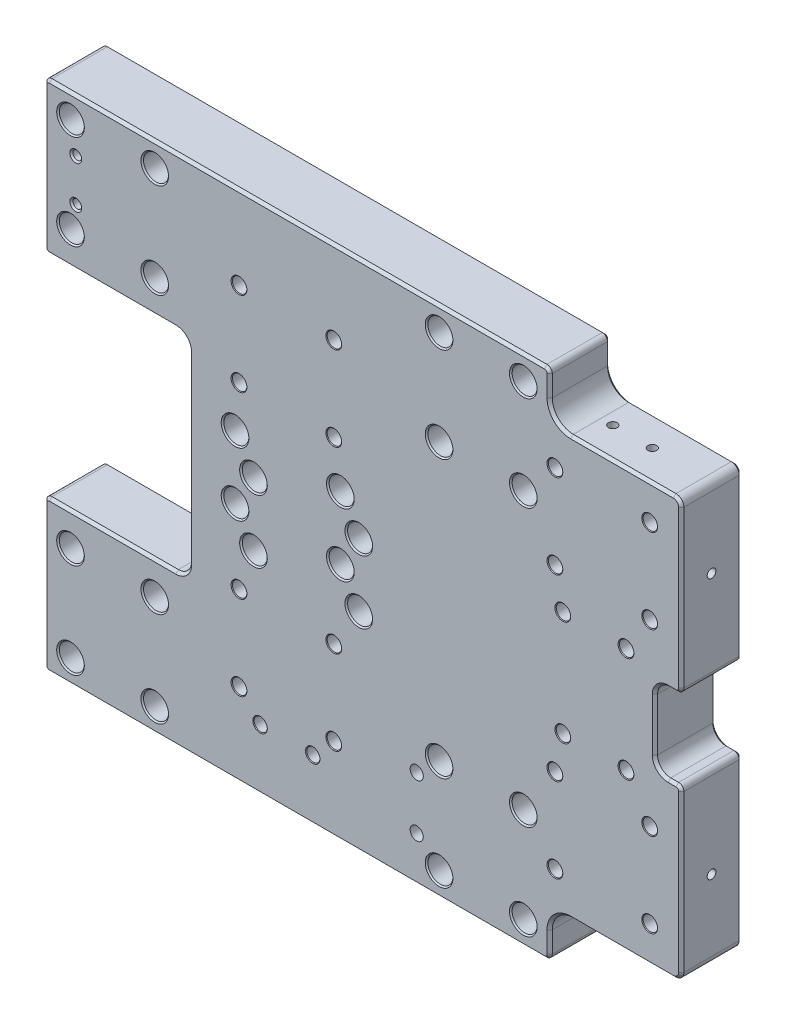
from build123d import *
from OCP.BRepFilletAPI import BRepFilletAPI_MakeFillet

# Parameters (mm, degrees)
SKETCH1_W                                     = 242
SKETCH1_H                                     = 195
BASE_FLANGE1_DEPTH                            = 23
CBORE_FOR_M5_HEX_SOCKET_HEAD_CAP_SCR_2_COUNT  = 2
CBORE_FOR_M5_HEX_SOCKET_HEAD_CAP_SCR_2_PITCH  = 32
CBORE_FOR_M5_HEX_SOCKET_HEAD_CAP_SCR_3_COUNT  = 2
CBORE_FOR_M5_HEX_SOCKET_HEAD_CAP_SCR_3_PITCH  = 48.166378315
CBORE_FOR_M5_HEX_SOCKET_HEAD_CAP_SCR_4_COUNT  = 2
CBORE_FOR_M5_HEX_SOCKET_HEAD_CAP_SCR_4_PITCH  = 36
CBORE_FOR_M5_HEX_SOCKET_HEAD_CAP_SCR_5_COUNT  = 2
CBORE_FOR_M5_HEX_SOCKET_HEAD_CAP_SCR_5_PITCH  = 140
CBORE_FOR_M5_HEX_SOCKET_HEAD_CAP_SCR_6_COUNT  = 2
CBORE_FOR_M5_HEX_SOCKET_HEAD_CAP_SCR_6_PITCH  = 172
CBORE_FOR_M5_HEX_SOCKET_HEAD_CAP_SCR_7_COUNT  = 2
CBORE_FOR_M5_HEX_SOCKET_HEAD_CAP_SCR_7_PITCH  = 175.727061092
CBORE_FOR_M5_HEX_SOCKET_HEAD_CAP_SCR_8_COUNT  = 2
CBORE_FOR_M5_HEX_SOCKET_HEAD_CAP_SCR_8_PITCH  = 144.554487997
CBORE_FOR_M5_HEX_SOCKET_HEAD_CAP_SCR_9_COUNT  = 2
CBORE_FOR_M5_HEX_SOCKET_HEAD_CAP_SCR_9_PITCH  = 198.698263707
CBORE_FOR_M5_HEX_SOCKET_HEAD_CAP_SCR_10_COUNT = 2
CBORE_FOR_M5_HEX_SOCKET_HEAD_CAP_SCR_10_PITCH = 222.407284053
CBORE_FOR_M5_HEX_SOCKET_HEAD_CAP_SCR_11_COUNT = 2
CBORE_FOR_M5_HEX_SOCKET_HEAD_CAP_SCR_11_PITCH = 246.805591509
CBORE_FOR_M5_HEX_SOCKET_HEAD_CAP_SCR_12_COUNT = 2
CBORE_FOR_M5_HEX_SOCKET_HEAD_CAP_SCR_12_PITCH = 225.674544422
CBORE_FOR_M5_HEX_SOCKET_HEAD_CAP_SCR_13_COUNT = 2
CBORE_FOR_M5_HEX_SOCKET_HEAD_CAP_SCR_13_PITCH = 141
CBORE_FOR_M5_HEX_SOCKET_HEAD_CAP_SCR_14_COUNT = 2
CBORE_FOR_M5_HEX_SOCKET_HEAD_CAP_SCR_14_PITCH = 144.585614775
CBORE_FOR_M5_HEX_SOCKET_HEAD_CAP_SCR_15_COUNT = 2
CBORE_FOR_M5_HEX_SOCKET_HEAD_CAP_SCR_15_PITCH = 179.869397064
CBORE_FOR_M5_HEX_SOCKET_HEAD_CAP_SCR_16_COUNT = 2
CBORE_FOR_M5_HEX_SOCKET_HEAD_CAP_SCR_16_PITCH = 177
CBORE_FOR_M5_HEX_SOCKET_HEAD_CAP_SCR_17_COUNT = 2
CBORE_FOR_M5_HEX_SOCKET_HEAD_CAP_SCR_17_PITCH = 40
CBORE_FOR_M5_HEX_SOCKET_HEAD_CAP_SCR_18_COUNT = 2
CBORE_FOR_M5_HEX_SOCKET_HEAD_CAP_SCR_18_PITCH = 46.647615159
CBORE_FOR_M5_HEX_SOCKET_HEAD_CAP_SCR_19_COUNT = 2
CBORE_FOR_M5_HEX_SOCKET_HEAD_CAP_SCR_19_PITCH = 24
CBORE_FOR_M5_HEX_SOCKET_HEAD_CAP_SCR_20_COUNT = 2
CBORE_FOR_M5_HEX_SOCKET_HEAD_CAP_SCR_20_PITCH = 13.892443989
CBORE_FOR_M5_HEX_SOCKET_HEAD_CAP_SCR_21_COUNT = 2
CBORE_FOR_M5_HEX_SOCKET_HEAD_CAP_SCR_21_PITCH = 35.114099732
CBORE_FOR_M5_HEX_SOCKET_HEAD_CAP_SCR_22_COUNT = 2
CBORE_FOR_M5_HEX_SOCKET_HEAD_CAP_SCR_22_PITCH = 48.836461788
CBORE_FOR_M5_HEX_SOCKET_HEAD_CAP_SCR_23_COUNT = 2
CBORE_FOR_M5_HEX_SOCKET_HEAD_CAP_SCR_23_PITCH = 36.674241642
CBORE_FOR_M5_HEX_SOCKET_HEAD_CAP_SCR_24_COUNT = 2
CBORE_FOR_M5_HEX_SOCKET_HEAD_CAP_SCR_24_PITCH = 36
CBORE_FOR_M5_HEX_SOCKET_HEAD_CAP_SCR_25_COUNT = 2
CBORE_FOR_M5_HEX_SOCKET_HEAD_CAP_SCR_25_PITCH = 48.166378315
CBORE_FOR_M5_HEX_SOCKET_HEAD_CAP_SCR_26_COUNT = 2
CBORE_FOR_M5_HEX_SOCKET_HEAD_CAP_SCR_26_PITCH = 32
CBORE_FOR_M5_HEX_SOCKET_HEAD_CAP_SCR_27_COUNT = 2
CBORE_FOR_M5_HEX_SOCKET_HEAD_CAP_SCR_27_PITCH = 106.282642045
CBORE_FOR_M5_HEX_SOCKET_HEAD_CAP_SCR_28_COUNT = 2
CBORE_FOR_M5_HEX_SOCKET_HEAD_CAP_SCR_28_PITCH = 136.821051012
CBORE_FOR_M5_HEX_SOCKET_HEAD_CAP_SCR_29_COUNT = 2
CBORE_FOR_M5_HEX_SOCKET_HEAD_CAP_SCR_29_PITCH = 100
CBORE_FOR_M5_HEX_SOCKET_HEAD_CAP_SCR_30_COUNT = 2
CBORE_FOR_M5_HEX_SOCKET_HEAD_CAP_SCR_30_PITCH = 132
CBORE_FOR_M5_HEX_SOCKET_HEAD_CAP_SCR_31_COUNT = 2
CBORE_FOR_M5_HEX_SOCKET_HEAD_CAP_SCR_31_PITCH = 120
CBORE_FOR_M5_HEX_SOCKET_HEAD_CAP_SCR_32_COUNT = 2
CBORE_FOR_M5_HEX_SOCKET_HEAD_CAP_SCR_32_PITCH = 156
CBORE_FOR_M5_HEX_SOCKET_HEAD_CAP_SCR_33_COUNT = 2
CBORE_FOR_M5_HEX_SOCKET_HEAD_CAP_SCR_33_PITCH = 159.248233899
CBORE_FOR_M5_HEX_SOCKET_HEAD_CAP_SCR_34_COUNT = 2
CBORE_FOR_M5_HEX_SOCKET_HEAD_CAP_SCR_34_PITCH = 124.19339757
CBORE_FOR_M5_HEX_SOCKET_HEAD_CAP_SCR_35_COUNT = 2
CBORE_FOR_M5_HEX_SOCKET_HEAD_CAP_SCR_35_PITCH = 185.29975715
CBORE_FOR_M5_HEX_SOCKET_HEAD_CAP_SCR_36_COUNT = 2
CBORE_FOR_M5_HEX_SOCKET_HEAD_CAP_SCR_36_PITCH = 204.352636391
CBORE_FOR_M5_HEX_SOCKET_HEAD_CAP_SCR_37_COUNT = 2
CBORE_FOR_M5_HEX_SOCKET_HEAD_CAP_SCR_37_PITCH = 156.204993518
CBORE_FOR_M5_HEX_SOCKET_HEAD_CAP_SCR_38_COUNT = 2
CBORE_FOR_M5_HEX_SOCKET_HEAD_CAP_SCR_38_PITCH = 178.392824968
CBORE_FOR_M5_HEX_SOCKET_HEAD_CAP_SCR_39_COUNT = 2
CBORE_FOR_M5_HEX_SOCKET_HEAD_CAP_SCR_39_PITCH = 40
CBORE_FOR_M5_HEX_SOCKET_HEAD_CAP_SCR_40_COUNT = 2
CBORE_FOR_M5_HEX_SOCKET_HEAD_CAP_SCR_40_PITCH = 46.647615159
CBORE_FOR_M5_HEX_SOCKET_HEAD_CAP_SCR_41_COUNT = 2
CBORE_FOR_M5_HEX_SOCKET_HEAD_CAP_SCR_41_PITCH = 24
CUT_EXTRUDE1_REACH                            = 159.087
SKETCH14_W                                    = 55
SKETCH14_H                                    = 80
SKETCH14_W_2                                  = 10
SKETCH14_H_2                                  = 30
M4_TAPPED_HOLE1_AT_2_COUNT                    = 2
M4_TAPPED_HOLE1_AT_2_PITCH                    = 16
CUT_EXTRUDE2_REACH                            = 159.087
SKETCH23_W                                    = 50
SKETCH23_H                                    = 18
F_5_0MM_DOWEL_HOLE1_D                         = 5
F_5_0MM_DOWEL_HOLE1_CSINK_D                   = 5.5
F_5_0MM_DOWEL_HOLE1_CSINK_ANGLE               = 90
F_5_0MM_DOWEL_HOLE2_D                         = 5
F_5_0MM_DOWEL_HOLE2_CSINK_D                   = 5.5
F_5_0MM_DOWEL_HOLE2_CSINK_ANGLE               = 90
FILLET1_R1                                    = 3
FILLET1_R2                                    = 5
FILLET1_R3                                    = 2
FILLET1_R4                                    = 8
CHAMFER1_SIZE                                 = 1
M4_TAPPED_HOLE2_AT_2_COUNT                    = 2
M4_TAPPED_HOLE2_AT_2_PITCH                    = 15


# Sheet-metal steps are written as plain solids
with BuildPart() as part:
    # Sketch1 → Base-Flange1 (new body)
    with BuildSketch(Plane.XY):
        Rectangle(SKETCH1_W, SKETCH1_H)
    extrude(amount=-BASE_FLANGE1_DEPTH)

    # Sketch8 → CBORE for M5 Hex Socket Head Cap Screw1 (revolve, cut)
    with BuildSketch(Plane(origin=(61, 88.5, 0), x_dir=(0, -1, 0), z_dir=(1, 0, 0))):
        Polygon((0, 0), (0, 23), (3, 23), (2.75, 22.75), (2.75, 8), (4.75, 8), (4.75, 0.5), (5.25, 0), align=None)
    cbore_for_m5_hex_socket_head_cap_screw1 = revolve(axis=Axis((61, 88.5, 6.35), (0, 0, -1)), mode=Mode.SUBTRACT)

    # CBORE for M5 Hex Socket Head Cap Scr 2: CBORE for M5 Hex Socket Head Cap Screw1 ×2
    with Locations(*[(-i * CBORE_FOR_M5_HEX_SOCKET_HEAD_CAP_SCR_2_PITCH, 0, 0) for i in range(1, CBORE_FOR_M5_HEX_SOCKET_HEAD_CAP_SCR_2_COUNT)]):
        add(cbore_for_m5_hex_socket_head_cap_screw1, mode=Mode.SUBTRACT)

    # CBORE for M5 Hex Socket Head Cap Scr 3: CBORE for M5 Hex Socket Head Cap Screw1 ×2
    with Locations(*[Vector(-0.6643638388299198, -0.7474093186836599, 0) * (i * CBORE_FOR_M5_HEX_SOCKET_HEAD_CAP_SCR_3_PITCH) for i in range(1, CBORE_FOR_M5_HEX_SOCKET_HEAD_CAP_SCR_3_COUNT)]):
        add(cbore_for_m5_hex_socket_head_cap_screw1, mode=Mode.SUBTRACT)

    # CBORE for M5 Hex Socket Head Cap Scr 4: CBORE for M5 Hex Socket Head Cap Screw1 ×2
    with Locations(*[(0, -i * CBORE_FOR_M5_HEX_SOCKET_HEAD_CAP_SCR_4_PITCH, 0) for i in range(1, CBORE_FOR_M5_HEX_SOCKET_HEAD_CAP_SCR_4_COUNT)]):
        add(cbore_for_m5_hex_socket_head_cap_screw1, mode=Mode.SUBTRACT)

    # CBORE for M5 Hex Socket Head Cap Scr 5: CBORE for M5 Hex Socket Head Cap Screw1 ×2
    with Locations(*[(-i * CBORE_FOR_M5_HEX_SOCKET_HEAD_CAP_SCR_5_PITCH, 0, 0) for i in range(1, CBORE_FOR_M5_HEX_SOCKET_HEAD_CAP_SCR_5_COUNT)]):
        add(cbore_for_m5_hex_socket_head_cap_screw1, mode=Mode.SUBTRACT)

    # CBORE for M5 Hex Socket Head Cap Scr 6: CBORE for M5 Hex Socket Head Cap Screw1 ×2
    with Locations(*[(-i * CBORE_FOR_M5_HEX_SOCKET_HEAD_CAP_SCR_6_PITCH, 0, 0) for i in range(1, CBORE_FOR_M5_HEX_SOCKET_HEAD_CAP_SCR_6_COUNT)]):
        add(cbore_for_m5_hex_socket_head_cap_screw1, mode=Mode.SUBTRACT)

    # CBORE for M5 Hex Socket Head Cap Scr 7: CBORE for M5 Hex Socket Head Cap Screw1 ×2
    with Locations(*[Vector(-0.9787906252528686, -0.20486315412269354, 0) * (i * CBORE_FOR_M5_HEX_SOCKET_HEAD_CAP_SCR_7_PITCH) for i in range(1, CBORE_FOR_M5_HEX_SOCKET_HEAD_CAP_SCR_7_COUNT)]):
        add(cbore_for_m5_hex_socket_head_cap_screw1, mode=Mode.SUBTRACT)

    # CBORE for M5 Hex Socket Head Cap Scr 8: CBORE for M5 Hex Socket Head Cap Screw1 ×2
    with Locations(*[Vector(-0.9684929325968497, -0.24904103981061862, 0) * (i * CBORE_FOR_M5_HEX_SOCKET_HEAD_CAP_SCR_8_PITCH) for i in range(1, CBORE_FOR_M5_HEX_SOCKET_HEAD_CAP_SCR_8_COUNT)]):
        add(cbore_for_m5_hex_socket_head_cap_screw1, mode=Mode.SUBTRACT)

    # CBORE for M5 Hex Socket Head Cap Scr 9: CBORE for M5 Hex Socket Head Cap Screw1 ×2
    with Locations(*[Vector(-0.7045859253544188, -0.7096186819640937, 0) * (i * CBORE_FOR_M5_HEX_SOCKET_HEAD_CAP_SCR_9_PITCH) for i in range(1, CBORE_FOR_M5_HEX_SOCKET_HEAD_CAP_SCR_9_COUNT)]):
        add(cbore_for_m5_hex_socket_head_cap_screw1, mode=Mode.SUBTRACT)

    # CBORE for M5 Hex Socket Head Cap Scr 10: CBORE for M5 Hex Socket Head Cap Screw1 ×2
    with Locations(*[Vector(-0.7733559659796021, -0.6339720418786277, 0) * (i * CBORE_FOR_M5_HEX_SOCKET_HEAD_CAP_SCR_10_PITCH) for i in range(1, CBORE_FOR_M5_HEX_SOCKET_HEAD_CAP_SCR_10_COUNT)]):
        add(cbore_for_m5_hex_socket_head_cap_screw1, mode=Mode.SUBTRACT)

    # CBORE for M5 Hex Socket Head Cap Scr 11: CBORE for M5 Hex Socket Head Cap Screw1 ×2
    with Locations(*[Vector(-0.6969047943708334, -0.7171636546723115, 0) * (i * CBORE_FOR_M5_HEX_SOCKET_HEAD_CAP_SCR_11_PITCH) for i in range(1, CBORE_FOR_M5_HEX_SOCKET_HEAD_CAP_SCR_11_COUNT)]):
        add(cbore_for_m5_hex_socket_head_cap_screw1, mode=Mode.SUBTRACT)

    # CBORE for M5 Hex Socket Head Cap Scr 12: CBORE for M5 Hex Socket Head Cap Screw1 ×2
    with Locations(*[Vector(-0.6203623911534888, -0.7843153088154827, 0) * (i * CBORE_FOR_M5_HEX_SOCKET_HEAD_CAP_SCR_12_PITCH) for i in range(1, CBORE_FOR_M5_HEX_SOCKET_HEAD_CAP_SCR_12_COUNT)]):
        add(cbore_for_m5_hex_socket_head_cap_screw1, mode=Mode.SUBTRACT)

    # CBORE for M5 Hex Socket Head Cap Scr 13: CBORE for M5 Hex Socket Head Cap Screw1 ×2
    with Locations(*[(0, -i * CBORE_FOR_M5_HEX_SOCKET_HEAD_CAP_SCR_13_PITCH, 0) for i in range(1, CBORE_FOR_M5_HEX_SOCKET_HEAD_CAP_SCR_13_COUNT)]):
        add(cbore_for_m5_hex_socket_head_cap_screw1, mode=Mode.SUBTRACT)

    # CBORE for M5 Hex Socket Head Cap Scr 14: CBORE for M5 Hex Socket Head Cap Screw1 ×2
    with Locations(*[Vector(-0.2213221560782096, -0.9752007502196113, 0) * (i * CBORE_FOR_M5_HEX_SOCKET_HEAD_CAP_SCR_14_PITCH) for i in range(1, CBORE_FOR_M5_HEX_SOCKET_HEAD_CAP_SCR_14_COUNT)]):
        add(cbore_for_m5_hex_socket_head_cap_screw1, mode=Mode.SUBTRACT)

    # CBORE for M5 Hex Socket Head Cap Scr 15: CBORE for M5 Hex Socket Head Cap Screw1 ×2
    with Locations(*[Vector(-0.17790686199218475, -0.9840473303942722, 0) * (i * CBORE_FOR_M5_HEX_SOCKET_HEAD_CAP_SCR_15_PITCH) for i in range(1, CBORE_FOR_M5_HEX_SOCKET_HEAD_CAP_SCR_15_COUNT)]):
        add(cbore_for_m5_hex_socket_head_cap_screw1, mode=Mode.SUBTRACT)

    # CBORE for M5 Hex Socket Head Cap Scr 16: CBORE for M5 Hex Socket Head Cap Screw1 ×2
    with Locations(*[(0, -i * CBORE_FOR_M5_HEX_SOCKET_HEAD_CAP_SCR_16_PITCH, 0) for i in range(1, CBORE_FOR_M5_HEX_SOCKET_HEAD_CAP_SCR_16_COUNT)]):
        add(cbore_for_m5_hex_socket_head_cap_screw1, mode=Mode.SUBTRACT)

    # Sketch10 → CBORE for M5 Hex Socket Head Cap Screw2 (revolve, cut)
    with BuildSketch(Plane(origin=(-8.5, 17.5, 0), x_dir=(0, -1, 0), z_dir=(1, 0, 0))):
        Polygon((0, 0), (0, 23), (3, 23), (2.75, 22.75), (2.75, 8), (4.75, 8), (4.75, 0.5), (5.25, 0), align=None)
    cbore_for_m5_hex_socket_head_cap_screw2 = revolve(axis=Axis((-8.5, 17.5, 6.35), (0, 0, -1)), mode=Mode.SUBTRACT)

    # CBORE for M5 Hex Socket Head Cap Scr 17: CBORE for M5 Hex Socket Head Cap Screw2 ×2
    with Locations(*[(-i * CBORE_FOR_M5_HEX_SOCKET_HEAD_CAP_SCR_17_PITCH, 0, 0) for i in range(1, CBORE_FOR_M5_HEX_SOCKET_HEAD_CAP_SCR_17_COUNT)]):
        add(cbore_for_m5_hex_socket_head_cap_screw2, mode=Mode.SUBTRACT)

    # CBORE for M5 Hex Socket Head Cap Scr 18: CBORE for M5 Hex Socket Head Cap Screw2 ×2
    with Locations(*[Vector(-0.8574929257125441, -0.5144957554275267, 0) * (i * CBORE_FOR_M5_HEX_SOCKET_HEAD_CAP_SCR_18_PITCH) for i in range(1, CBORE_FOR_M5_HEX_SOCKET_HEAD_CAP_SCR_18_COUNT)]):
        add(cbore_for_m5_hex_socket_head_cap_screw2, mode=Mode.SUBTRACT)

    # CBORE for M5 Hex Socket Head Cap Scr 19: CBORE for M5 Hex Socket Head Cap Screw2 ×2
    with Locations(*[(0, -i * CBORE_FOR_M5_HEX_SOCKET_HEAD_CAP_SCR_19_PITCH, 0) for i in range(1, CBORE_FOR_M5_HEX_SOCKET_HEAD_CAP_SCR_19_COUNT)]):
        add(cbore_for_m5_hex_socket_head_cap_screw2, mode=Mode.SUBTRACT)

    # CBORE for M5 Hex Socket Head Cap Scr 20: CBORE for M5 Hex Socket Head Cap Screw2 ×2
    with Locations(*[Vector(0.5038710255240865, -0.8637789008984332, 0) * (i * CBORE_FOR_M5_HEX_SOCKET_HEAD_CAP_SCR_20_PITCH) for i in range(1, CBORE_FOR_M5_HEX_SOCKET_HEAD_CAP_SCR_20_COUNT)]):
        add(cbore_for_m5_hex_socket_head_cap_screw2, mode=Mode.SUBTRACT)

    # CBORE for M5 Hex Socket Head Cap Scr 21: CBORE for M5 Hex Socket Head Cap Screw2 ×2
    with Locations(*[Vector(-0.9397934234884372, -0.34174306308670416, 0) * (i * CBORE_FOR_M5_HEX_SOCKET_HEAD_CAP_SCR_21_PITCH) for i in range(1, CBORE_FOR_M5_HEX_SOCKET_HEAD_CAP_SCR_21_COUNT)]):
        add(cbore_for_m5_hex_socket_head_cap_screw2, mode=Mode.SUBTRACT)

    # CBORE for M5 Hex Socket Head Cap Scr 22: CBORE for M5 Hex Socket Head Cap Screw2 ×2
    with Locations(*[Vector(-0.6757246285173464, -0.7371541402007413, 0) * (i * CBORE_FOR_M5_HEX_SOCKET_HEAD_CAP_SCR_22_PITCH) for i in range(1, CBORE_FOR_M5_HEX_SOCKET_HEAD_CAP_SCR_22_COUNT)]):
        add(cbore_for_m5_hex_socket_head_cap_screw2, mode=Mode.SUBTRACT)

    # CBORE for M5 Hex Socket Head Cap Scr 23: CBORE for M5 Hex Socket Head Cap Screw2 ×2
    with Locations(*[Vector(0.19086965910222412, -0.9816153896685813, 0) * (i * CBORE_FOR_M5_HEX_SOCKET_HEAD_CAP_SCR_23_PITCH) for i in range(1, CBORE_FOR_M5_HEX_SOCKET_HEAD_CAP_SCR_23_COUNT)]):
        add(cbore_for_m5_hex_socket_head_cap_screw2, mode=Mode.SUBTRACT)

    # Sketch13 → CBORE for M5 Hex Socket Head Cap Screw3 (revolve, cut)
    with BuildSketch(Plane(origin=(-47, 66, -23), x_dir=(0, 1, 0), z_dir=(1, 0, 0))):
        Polygon((0, 0), (0, 23), (3, 23), (2.75, 22.75), (2.75, 8), (4.75, 8), (4.75, 0.5), (5.25, 0), align=None)
    cbore_for_m5_hex_socket_head_cap_screw3 = revolve(axis=Axis((-47, 66, -29.35), (0, 0, 1)), mode=Mode.SUBTRACT)

    # CBORE for M5 Hex Socket Head Cap Scr 24: CBORE for M5 Hex Socket Head Cap Screw3 ×2
    with Locations(*[(i * CBORE_FOR_M5_HEX_SOCKET_HEAD_CAP_SCR_24_PITCH, 0, 0) for i in range(1, CBORE_FOR_M5_HEX_SOCKET_HEAD_CAP_SCR_24_COUNT)]):
        add(cbore_for_m5_hex_socket_head_cap_screw3, mode=Mode.SUBTRACT)

    # CBORE for M5 Hex Socket Head Cap Scr 25: CBORE for M5 Hex Socket Head Cap Screw3 ×2
    with Locations(*[Vector(0.7474093186836551, -0.6643638388299249, 0) * (i * CBORE_FOR_M5_HEX_SOCKET_HEAD_CAP_SCR_25_PITCH) for i in range(1, CBORE_FOR_M5_HEX_SOCKET_HEAD_CAP_SCR_25_COUNT)]):
        add(cbore_for_m5_hex_socket_head_cap_screw3, mode=Mode.SUBTRACT)

    # CBORE for M5 Hex Socket Head Cap Scr 26: CBORE for M5 Hex Socket Head Cap Screw3 ×2
    with Locations(*[(0, -i * CBORE_FOR_M5_HEX_SOCKET_HEAD_CAP_SCR_26_PITCH, 0) for i in range(1, CBORE_FOR_M5_HEX_SOCKET_HEAD_CAP_SCR_26_COUNT)]):
        add(cbore_for_m5_hex_socket_head_cap_screw3, mode=Mode.SUBTRACT)

    # CBORE for M5 Hex Socket Head Cap Scr 27: CBORE for M5 Hex Socket Head Cap Screw3 ×2
    with Locations(*[Vector(0.3387194682727424, -0.9408874118687266, 0) * (i * CBORE_FOR_M5_HEX_SOCKET_HEAD_CAP_SCR_27_PITCH) for i in range(1, CBORE_FOR_M5_HEX_SOCKET_HEAD_CAP_SCR_27_COUNT)]):
        add(cbore_for_m5_hex_socket_head_cap_screw3, mode=Mode.SUBTRACT)

    # CBORE for M5 Hex Socket Head Cap Scr 28: CBORE for M5 Hex Socket Head Cap Screw3 ×2
    with Locations(*[Vector(0.2631174057921073, -0.9647638212377325, 0) * (i * CBORE_FOR_M5_HEX_SOCKET_HEAD_CAP_SCR_28_PITCH) for i in range(1, CBORE_FOR_M5_HEX_SOCKET_HEAD_CAP_SCR_28_COUNT)]):
        add(cbore_for_m5_hex_socket_head_cap_screw3, mode=Mode.SUBTRACT)

    # CBORE for M5 Hex Socket Head Cap Scr 29: CBORE for M5 Hex Socket Head Cap Screw3 ×2
    with Locations(*[(0, -i * CBORE_FOR_M5_HEX_SOCKET_HEAD_CAP_SCR_29_PITCH, 0) for i in range(1, CBORE_FOR_M5_HEX_SOCKET_HEAD_CAP_SCR_29_COUNT)]):
        add(cbore_for_m5_hex_socket_head_cap_screw3, mode=Mode.SUBTRACT)

    # CBORE for M5 Hex Socket Head Cap Scr 30: CBORE for M5 Hex Socket Head Cap Screw3 ×2
    with Locations(*[(0, -i * CBORE_FOR_M5_HEX_SOCKET_HEAD_CAP_SCR_30_PITCH, 0) for i in range(1, CBORE_FOR_M5_HEX_SOCKET_HEAD_CAP_SCR_30_COUNT)]):
        add(cbore_for_m5_hex_socket_head_cap_screw3, mode=Mode.SUBTRACT)

    # CBORE for M5 Hex Socket Head Cap Scr 31: CBORE for M5 Hex Socket Head Cap Screw3 ×2
    with Locations(*[(i * CBORE_FOR_M5_HEX_SOCKET_HEAD_CAP_SCR_31_PITCH, 0, 0) for i in range(1, CBORE_FOR_M5_HEX_SOCKET_HEAD_CAP_SCR_31_COUNT)]):
        add(cbore_for_m5_hex_socket_head_cap_screw3, mode=Mode.SUBTRACT)

    # CBORE for M5 Hex Socket Head Cap Scr 32: CBORE for M5 Hex Socket Head Cap Screw3 ×2
    with Locations(*[(i * CBORE_FOR_M5_HEX_SOCKET_HEAD_CAP_SCR_32_PITCH, 0, 0) for i in range(1, CBORE_FOR_M5_HEX_SOCKET_HEAD_CAP_SCR_32_COUNT)]):
        add(cbore_for_m5_hex_socket_head_cap_screw3, mode=Mode.SUBTRACT)

    # CBORE for M5 Hex Socket Head Cap Scr 33: CBORE for M5 Hex Socket Head Cap Screw3 ×2
    with Locations(*[Vector(0.9796027006414888, -0.20094414372133815, 0) * (i * CBORE_FOR_M5_HEX_SOCKET_HEAD_CAP_SCR_33_PITCH) for i in range(1, CBORE_FOR_M5_HEX_SOCKET_HEAD_CAP_SCR_33_COUNT)]):
        add(cbore_for_m5_hex_socket_head_cap_screw3, mode=Mode.SUBTRACT)

    # CBORE for M5 Hex Socket Head Cap Scr 34: CBORE for M5 Hex Socket Head Cap Screw3 ×2
    with Locations(*[Vector(0.9662349396012445, -0.25766265056033916, 0) * (i * CBORE_FOR_M5_HEX_SOCKET_HEAD_CAP_SCR_34_PITCH) for i in range(1, CBORE_FOR_M5_HEX_SOCKET_HEAD_CAP_SCR_34_COUNT)]):
        add(cbore_for_m5_hex_socket_head_cap_screw3, mode=Mode.SUBTRACT)

    # CBORE for M5 Hex Socket Head Cap Scr 35: CBORE for M5 Hex Socket Head Cap Screw3 ×2
    with Locations(*[Vector(0.8418791389638736, -0.5396661147204326, 0) * (i * CBORE_FOR_M5_HEX_SOCKET_HEAD_CAP_SCR_35_PITCH) for i in range(1, CBORE_FOR_M5_HEX_SOCKET_HEAD_CAP_SCR_35_COUNT)]):
        add(cbore_for_m5_hex_socket_head_cap_screw3, mode=Mode.SUBTRACT)

    # CBORE for M5 Hex Socket Head Cap Scr 36: CBORE for M5 Hex Socket Head Cap Screw3 ×2
    with Locations(*[Vector(0.7633862853691121, -0.6459422414661768, 0) * (i * CBORE_FOR_M5_HEX_SOCKET_HEAD_CAP_SCR_36_PITCH) for i in range(1, CBORE_FOR_M5_HEX_SOCKET_HEAD_CAP_SCR_36_COUNT)]):
        add(cbore_for_m5_hex_socket_head_cap_screw3, mode=Mode.SUBTRACT)

    # CBORE for M5 Hex Socket Head Cap Scr 37: CBORE for M5 Hex Socket Head Cap Screw3 ×2
    with Locations(*[Vector(0.7682212795973714, -0.6401843996644853, 0) * (i * CBORE_FOR_M5_HEX_SOCKET_HEAD_CAP_SCR_37_PITCH) for i in range(1, CBORE_FOR_M5_HEX_SOCKET_HEAD_CAP_SCR_37_COUNT)]):
        add(cbore_for_m5_hex_socket_head_cap_screw3, mode=Mode.SUBTRACT)

    # CBORE for M5 Hex Socket Head Cap Scr 38: CBORE for M5 Hex Socket Head Cap Screw3 ×2
    with Locations(*[Vector(0.672672793996308, -0.7399400733959478, 0) * (i * CBORE_FOR_M5_HEX_SOCKET_HEAD_CAP_SCR_38_PITCH) for i in range(1, CBORE_FOR_M5_HEX_SOCKET_HEAD_CAP_SCR_38_COUNT)]):
        add(cbore_for_m5_hex_socket_head_cap_screw3, mode=Mode.SUBTRACT)

    # Sketch16 → CBORE for M5 Hex Socket Head Cap Screw4 (revolve, cut)
    with BuildSketch(Plane(origin=(100, 20, -23), x_dir=(0, 1, 0), z_dir=(1, 0, 0))):
        Polygon((0, 0), (0, 23), (3, 23), (2.75, 22.75), (2.75, 8), (4.75, 8), (4.75, 0.5), (5.25, 0), align=None)
    cbore_for_m5_hex_socket_head_cap_screw4 = revolve(axis=Axis((100, 20, -29.35), (0, 0, 1)), mode=Mode.SUBTRACT)

    # CBORE for M5 Hex Socket Head Cap Scr 39: CBORE for M5 Hex Socket Head Cap Screw4 ×2
    with Locations(*[(0, -i * CBORE_FOR_M5_HEX_SOCKET_HEAD_CAP_SCR_39_PITCH, 0) for i in range(1, CBORE_FOR_M5_HEX_SOCKET_HEAD_CAP_SCR_39_COUNT)]):
        add(cbore_for_m5_hex_socket_head_cap_screw4, mode=Mode.SUBTRACT)

    # CBORE for M5 Hex Socket Head Cap Scr 40: CBORE for M5 Hex Socket Head Cap Screw4 ×2
    with Locations(*[Vector(-0.5144957554275263, -0.8574929257125444, 0) * (i * CBORE_FOR_M5_HEX_SOCKET_HEAD_CAP_SCR_40_PITCH) for i in range(1, CBORE_FOR_M5_HEX_SOCKET_HEAD_CAP_SCR_40_COUNT)]):
        add(cbore_for_m5_hex_socket_head_cap_screw4, mode=Mode.SUBTRACT)

    # CBORE for M5 Hex Socket Head Cap Scr 41: CBORE for M5 Hex Socket Head Cap Screw4 ×2
    with Locations(*[(-i * CBORE_FOR_M5_HEX_SOCKET_HEAD_CAP_SCR_41_PITCH, 0, 0) for i in range(1, CBORE_FOR_M5_HEX_SOCKET_HEAD_CAP_SCR_41_COUNT)]):
        add(cbore_for_m5_hex_socket_head_cap_screw4, mode=Mode.SUBTRACT)

    # Sketch14 → Cut-Extrude1 (cut, up to next)
    with BuildSketch(Plane(origin=(0, 0, -23), x_dir=(-1, 0, 0), z_dir=(0, 0, -1)), mode=Mode.PRIVATE) as cut_extrude1_sk1:
        with Locations((93.5, 0)):
            Rectangle(SKETCH14_W, SKETCH14_H)
    cut_extrude1_tool1 = extrude(cut_extrude1_sk1.sketch, amount=-CUT_EXTRUDE1_REACH, mode=Mode.PRIVATE) & part.part
    # Sketch14 → Cut-Extrude1 (cut, up to next)
    with BuildSketch(Plane(origin=(0, 0, -23), x_dir=(-1, 0, 0), z_dir=(0, 0, -1)), mode=Mode.PRIVATE) as cut_extrude1_sk2:
        with Locations((-116, 0)):
            Rectangle(SKETCH14_W_2, SKETCH14_H_2)
    cut_extrude1_tool2 = extrude(cut_extrude1_sk2.sketch, amount=-CUT_EXTRUDE1_REACH, mode=Mode.PRIVATE) & part.part
    add(cut_extrude1_tool1.solids().sort_by_distance((-93.5, 0, -23))[0], mode=Mode.SUBTRACT)
    add(cut_extrude1_tool2.solids().sort_by_distance((116, 0, -23))[0], mode=Mode.SUBTRACT)

    # Sketch22 → M4 Tapped Hole1 (revolve, cut)
    with BuildSketch(Plane(origin=(-109, 77.5, 0), x_dir=(0, -1, 0), z_dir=(1, 0, 0))):
        Polygon((0, 0), (0, 23), (2.25, 23), (1.65, 22.4), (1.65, 0.6), (2.25, 0), align=None)
    m4_tapped_hole1 = revolve(axis=Axis((-109, 77.5, 6.35), (0, 0, -1)), mode=Mode.SUBTRACT)

    # M4 Tapped Hole1 at 2: M4 Tapped Hole1 ×2
    with Locations(*[(0, -i * M4_TAPPED_HOLE1_AT_2_PITCH, 0) for i in range(1, M4_TAPPED_HOLE1_AT_2_COUNT)]):
        add(m4_tapped_hole1, mode=Mode.SUBTRACT)

    # Sketch23 → Cut-Extrude2 (cut, up to next)
    with BuildSketch(Plane.XY, mode=Mode.PRIVATE) as cut_extrude2_sk1:
        with Locations((96, 88.5)):
            Rectangle(SKETCH23_W, SKETCH23_H)
    cut_extrude2_tool1 = extrude(cut_extrude2_sk1.sketch, amount=-CUT_EXTRUDE2_REACH, mode=Mode.PRIVATE) & part.part
    # Sketch23 → Cut-Extrude2 (cut, up to next)
    with BuildSketch(Plane.XY, mode=Mode.PRIVATE) as cut_extrude2_sk2:
        with Locations((96, -88.5)):
            Rectangle(SKETCH23_W, SKETCH23_H)
    cut_extrude2_tool2 = extrude(cut_extrude2_sk2.sketch, amount=-CUT_EXTRUDE2_REACH, mode=Mode.PRIVATE) & part.part
    add(cut_extrude2_tool1.solids().sort_by_distance((96, 88.5, 0))[0], mode=Mode.SUBTRACT)
    add(cut_extrude2_tool2.solids().sort_by_distance((96, -88.5, 0))[0], mode=Mode.SUBTRACT)

    # Ø5.0mm Dowel Hole1 (through all)
    with Locations(Plane(origin=(0, 0, -23), x_dir=(-1, 0, 0), z_dir=(0, 0, -1))):
        with Locations((-20.5, -80.5), (-20.5, -60.5)):
            CounterSinkHole(F_5_0MM_DOWEL_HOLE1_D / 2, F_5_0MM_DOWEL_HOLE1_CSINK_D / 2, counter_sink_angle=F_5_0MM_DOWEL_HOLE1_CSINK_ANGLE)

    # Ø5.0mm Dowel Hole2 (through all)
    with Locations(Plane.XY):
        with Locations((-19, -74.5), (-39, -74.5)):
            CounterSinkHole(F_5_0MM_DOWEL_HOLE2_D / 2, F_5_0MM_DOWEL_HOLE2_CSINK_D / 2, counter_sink_angle=F_5_0MM_DOWEL_HOLE2_CSINK_ANGLE)

    # Fillet1: one fillet with a radius per group of edges: ONE call of the kernel's fillet builder (fillet() takes one radius for all edges)
    fillet1_edges_1 = [part.edges().sort_by_distance(p)[0] for p in [
        (121, -79.5, -11.5),
        (121, 79.5, -11.5),
    ]]
    fillet1_edges_2 = [part.edges().sort_by_distance(p)[0] for p in [
        (-66, 40, -11.5),
        (-66, -40, -11.5),
        (111, -15, -11.5),
        (111, 15, -11.5),
    ]]
    fillet1_edges_3 = [part.edges().sort_by_distance(p)[0] for p in [
        (-121, 97.5, -11.5),
        (-121, 40, -11.5),
        (-121, -40, -11.5),
        (-121, -97.5, -11.5),
        (121, -15, -11.5),
        (121, 15, -11.5),
        (71, -97.5, -11.5),
        (71, 97.5, -11.5),
    ]]
    fillet1_edges_4 = [part.edges().sort_by_distance(p)[0] for p in [
        (71, -79.5, -11.5),
        (71, 79.5, -11.5),
    ]]
    fillet1 = BRepFilletAPI_MakeFillet(part.part.solid().wrapped)
    for e in fillet1_edges_1:
        fillet1.Add(FILLET1_R1, e.wrapped)
    for e in fillet1_edges_2:
        fillet1.Add(FILLET1_R2, e.wrapped)
    for e in fillet1_edges_3:
        fillet1.Add(FILLET1_R3, e.wrapped)
    for e in fillet1_edges_4:
        fillet1.Add(FILLET1_R4, e.wrapped)
    add(Compound.cast(fillet1.Shape()), mode=Mode.REPLACE)

    # Chamfer1
    chamfer1_edges = [part.edges().sort_by_distance(p)[0] for p in [
        (98.5, 79.5, 0),
        (98.5, 79.5, -23),
        (71, 91.5, 0),
        (71, 91.5, -23),
        (71, -91.5, 0),
        (71, -91.5, -23),
        (98.5, -79.5, 0),
        (98.5, -79.5, -23),
        (-25, 97.5, 0),
        (-121, 68.75, 0),
        (-95, 40, 0),
        (-66, 0, 0),
        (-95, -40, 0),
        (-121, -68.75, 0),
        (-25, -97.5, 0),
        (121, -46.75, 0),
        (117.5, -15, 0),
        (111, 0, 0),
        (117.5, 15, 0),
        (121, 46.75, 0),
        (120.121320344, -78.621320344, 0),
        (120.121320344, 78.621320344, 0),
        (-120.414213562, 96.914213562, 0),
        (-120.414213562, 40.585786438, 0),
        (-120.414213562, -40.585786438, 0),
        (-120.414213562, -96.914213562, 0),
        (120.414213562, -15.585786438, 0),
        (120.414213562, 15.585786438, 0),
        (70.414213562, -96.914213562, 0),
        (70.414213562, 96.914213562, 0),
        (-25, 97.5, -23),
        (121, 46.75, -23),
        (117.5, 15, -23),
        (111, 0, -23),
        (117.5, -15, -23),
        (121, -46.75, -23),
        (-25, -97.5, -23),
        (-121, -68.75, -23),
        (-95, -40, -23),
        (-66, 0, -23),
        (-95, 40, -23),
        (-121, 68.75, -23),
        (120.121320344, -78.621320344, -23),
        (120.121320344, 78.621320344, -23),
        (-120.414213562, 96.914213562, -23),
        (-120.414213562, 40.585786438, -23),
        (-120.414213562, -40.585786438, -23),
        (-120.414213562, -96.914213562, -23),
        (120.414213562, -15.585786438, -23),
        (120.414213562, 15.585786438, -23),
        (70.414213562, -96.914213562, -23),
        (70.414213562, 96.914213562, -23),
        (73.343145751, 81.843145751, 0),
        (73.343145751, 81.843145751, -23),
        (73.343145751, -81.843145751, 0),
        (73.343145751, -81.843145751, -23),
        (112.464466094, 13.535533906, -23),
        (112.464466094, 13.535533906, 0),
        (112.464466094, -13.535533906, -23),
        (112.464466094, -13.535533906, 0),
        (-67.464466094, -38.535533906, -23),
        (-67.464466094, -38.535533906, 0),
        (-67.464466094, 38.535533906, -23),
        (-67.464466094, 38.535533906, 0),
    ]]
    chamfer(chamfer1_edges, length=CHAMFER1_SIZE)

    # Sketch30 → M4 Tapped Hole2 (revolve, cut)
    with BuildSketch(Plane(origin=(98.5, -79.5, -11.5), x_dir=(0, 0, -1), z_dir=(1, 0, 0))):
        Polygon((0, 0), (0, 11.5), (1.65, 10.508579979), (1.65, 0), align=None)
    m4_tapped_hole2 = revolve(axis=Axis((98.5, -85.85, -11.5), (0, 1, 0)), mode=Mode.SUBTRACT)

    # M4 Tapped Hole2 at 2: M4 Tapped Hole2 ×2
    with Locations(*[(-i * M4_TAPPED_HOLE2_AT_2_PITCH, 0, 0) for i in range(1, M4_TAPPED_HOLE2_AT_2_COUNT)]):
        add(m4_tapped_hole2, mode=Mode.SUBTRACT)

    # Sketch32 → M4 Tapped Hole3 (revolve, cut)
    with BuildSketch(Plane(origin=(121, -49.5, -11.5), x_dir=(0, 0, -1), z_dir=(0, 1, 0))):
        Polygon((0, 0), (0, 11.5), (1.65, 10.508579979), (1.65, 0), align=None)
    m4_tapped_hole3 = revolve(axis=Axis((127.35, -49.5, -11.5), (-1, 0, 0)), mode=Mode.SUBTRACT)

    # Mirror1: M4 Tapped Hole2, M4 Tapped Hole3 across plane
    add(m4_tapped_hole2.mirror(Plane.ZX), mode=Mode.SUBTRACT)
    add(m4_tapped_hole3.mirror(Plane.ZX), mode=Mode.SUBTRACT)

    # Mirror1 copy 1 sketch → Mirror1 copy 1 (revolve, cut)
    with BuildSketch(Plane(origin=(83.5, 79.5, -11.5), x_dir=(0, 0, -1), z_dir=(1, 0, 0))):
        Polygon((0, 0), (0, -11.5), (1.65, -10.508579979), (1.65, 0), align=None)
    revolve(axis=Axis((83.5, 85.85, -11.5), (0, 1, 0)), mode=Mode.SUBTRACT)


solid = part.part
